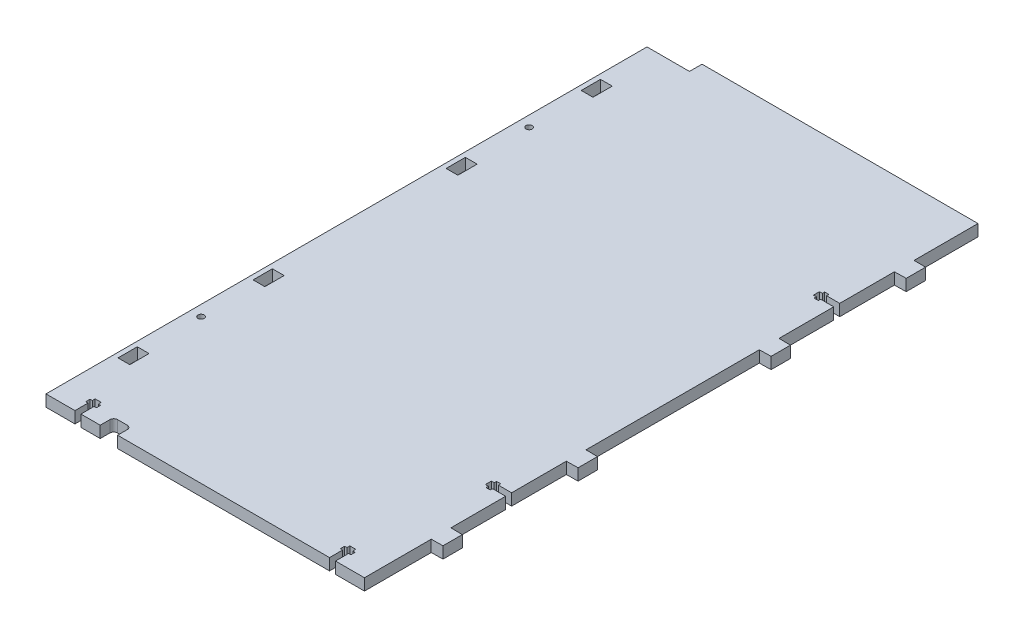
from build123d import *

# Parameters (mm, degrees)
SKETCH_1_R      = 1.6
SKETCH_1_W      = 6.1
SKETCH_1_H      = 10
EXTRUDE_1_DEPTH = 6


with BuildPart() as part:
    # Эскиз1 → Бобышка-Вытянуть1 (new body)
    with BuildSketch(Plane(origin=(0, 0, 6), x_dir=(1, 0, 0), z_dir=(0, 1, 0))):
        with BuildLine():
            Line((933.155518961, 517.721066), (933.155518961, 552.32339))
            Line((933.155518961, 552.32339), (939.155518961, 552.42339))
            Line((939.155518961, 552.42339), (939.155518961, 562.42339))
            Line((939.155518961, 562.42339), (933.155518961, 562.52339))
            Line((933.155518961, 562.52339), (933.155518961, 590.87339))
            Line((933.155518961, 590.87339), (926.355518961, 590.87339))
            Line((926.355518961, 590.87339), (926.355518961, 589.67339))
            Line((926.355518961, 589.67339), (924.155518961, 589.67339))
            Line((924.155518961, 589.67339), (924.155518961, 590.87339))
            Line((924.155518961, 590.87339), (922.655518961, 590.87339))
            Line((922.655518961, 590.87339), (922.655518961, 593.97339))
            Line((922.655518961, 593.97339), (924.155518961, 593.97339))
            Line((924.155518961, 593.97339), (924.155518961, 595.17339))
            Line((924.155518961, 595.17339), (926.355518961, 595.17339))
            Line((926.355518961, 595.17339), (926.355518961, 593.97339))
            Line((926.355518961, 593.97339), (933.155518961, 593.97339))
            Line((933.155518961, 593.97339), (933.155518961, 622.32339))
            Line((933.155518961, 622.32339), (939.155518961, 622.42339))
            Line((939.155518961, 622.42339), (939.155518961, 632.42339))
            Line((939.155518961, 632.42339), (933.155518961, 632.52339))
            Line((933.155518961, 632.52339), (933.155518961, 722.32339))
            Line((933.155518961, 722.32339), (939.155518961, 722.42339))
            Line((939.155518961, 722.42339), (939.155518961, 732.42339))
            Line((939.155518961, 732.42339), (933.155518961, 732.52339))
            Line((933.155518961, 732.52339), (933.155518961, 760.87339))
            Line((933.155518961, 760.87339), (926.355518961, 760.87339))
            Line((926.355518961, 760.87339), (926.355518961, 759.67339))
            Line((926.355518961, 759.67339), (924.155518961, 759.67339))
            Line((924.155518961, 759.67339), (924.155518961, 760.87339))
            Line((924.155518961, 760.87339), (922.655518961, 760.87339))
            Line((922.655518961, 760.87339), (922.655518961, 763.97339))
            Line((922.655518961, 763.97339), (924.155518961, 763.97339))
            Line((924.155518961, 763.97339), (924.155518961, 765.17339))
            Line((924.155518961, 765.17339), (926.355518961, 765.17339))
            Line((926.355518961, 765.17339), (926.355518961, 763.97339))
            Line((926.355518961, 763.97339), (933.155518961, 763.97339))
            Line((933.155518961, 763.97339), (933.155518961, 792.32339))
            Line((933.155518961, 792.32339), (939.155518961, 792.42339))
            Line((939.155518961, 792.42339), (939.155518961, 802.42339))
            Line((939.155518961, 802.42339), (933.155518961, 802.52339))
            Line((933.155518961, 802.52339), (933.155518961, 835.62339))
            Line((933.155518961, 835.62339), (833.155518961, 835.62339))
            Line((833.155518961, 835.62339), (790.155518961, 835.62339))
            Line((790.155518961, 835.62339), (790.155518961, 829.12339))
            Line((790.155518961, 829.12339), (768.155518961, 829.12339))
            Line((768.155518961, 829.12339), (768.155518961, 517.721066))
            Line((768.155518961, 517.721066), (783.155518961, 517.721066))
            Line((783.155518961, 517.721066), (783.155518961, 524.521066))
            Line((783.155518961, 524.521066), (781.955518961, 524.521066))
            Line((781.955518961, 524.521066), (781.955518961, 526.721066))
            Line((781.955518961, 526.721066), (783.155518961, 526.721066))
            Line((783.155518961, 526.721066), (783.155518961, 528.221066))
            Line((783.155518961, 528.221066), (786.255518961, 528.221066))
            Line((786.255518961, 528.221066), (786.255518961, 526.721066))
            Line((786.255518961, 526.721066), (787.455518961, 526.721066))
            Line((787.455518961, 526.721066), (787.455518961, 524.521066))
            Line((787.455518961, 524.521066), (786.255518961, 524.521066))
            Line((786.255518961, 524.521066), (786.255518961, 517.721066))
            Line((786.255518961, 517.721066), (796.255518961, 517.721066))
            Line((796.255518961, 517.721066), (796.255518961, 522.721066))
            ThreePointArc((796.255518961, 522.721066), (796.841305399, 524.135279562), (798.255518961, 524.721066))
            Line((798.255518961, 524.721066), (803.255518961, 524.721066))
            ThreePointArc((803.255518961, 524.721066), (804.669732523, 524.135279562), (805.255518961, 522.721066))
            Line((805.255518961, 522.721066), (805.255518961, 517.721066))
            Line((805.255518961, 517.721066), (833.155518961, 517.721066))
            Line((833.155518961, 517.721066), (915.055518961, 517.721066))
            Line((915.055518961, 517.721066), (915.055518961, 524.521066))
            Line((915.055518961, 524.521066), (913.855518961, 524.521066))
            Line((913.855518961, 524.521066), (913.855518961, 526.721066))
            Line((913.855518961, 526.721066), (915.055518961, 526.721066))
            Line((915.055518961, 526.721066), (915.055518961, 528.221066))
            Line((915.055518961, 528.221066), (918.155518961, 528.221066))
            Line((918.155518961, 528.221066), (918.155518961, 526.721066))
            Line((918.155518961, 526.721066), (919.355518961, 526.721066))
            Line((919.355518961, 526.721066), (919.355518961, 524.521066))
            Line((919.355518961, 524.521066), (918.155518961, 524.521066))
            Line((918.155518961, 524.521066), (918.155518961, 517.721066))
            Line((918.155518961, 517.721066), (933.155518961, 517.721066))
        make_face()
        with Locations((773.705518961, 592.52339)):
            Circle(SKETCH_1_R, mode=Mode.SUBTRACT)
        with Locations((773.705518961, 762.52339)):
            Circle(SKETCH_1_R, mode=Mode.SUBTRACT)
        with Locations((773.705518961, 557.52339)):
            Rectangle(SKETCH_1_W, SKETCH_1_H, mode=Mode.SUBTRACT)
        with Locations((773.705518961, 627.52339)):
            Rectangle(SKETCH_1_W, SKETCH_1_H, mode=Mode.SUBTRACT)
        with Locations((773.705518961, 727.52339)):
            Rectangle(SKETCH_1_W, SKETCH_1_H, mode=Mode.SUBTRACT)
        with Locations((773.705518961, 797.52339)):
            Rectangle(SKETCH_1_W, SKETCH_1_H, mode=Mode.SUBTRACT)
    extrude(amount=-EXTRUDE_1_DEPTH)


solid = part.part
